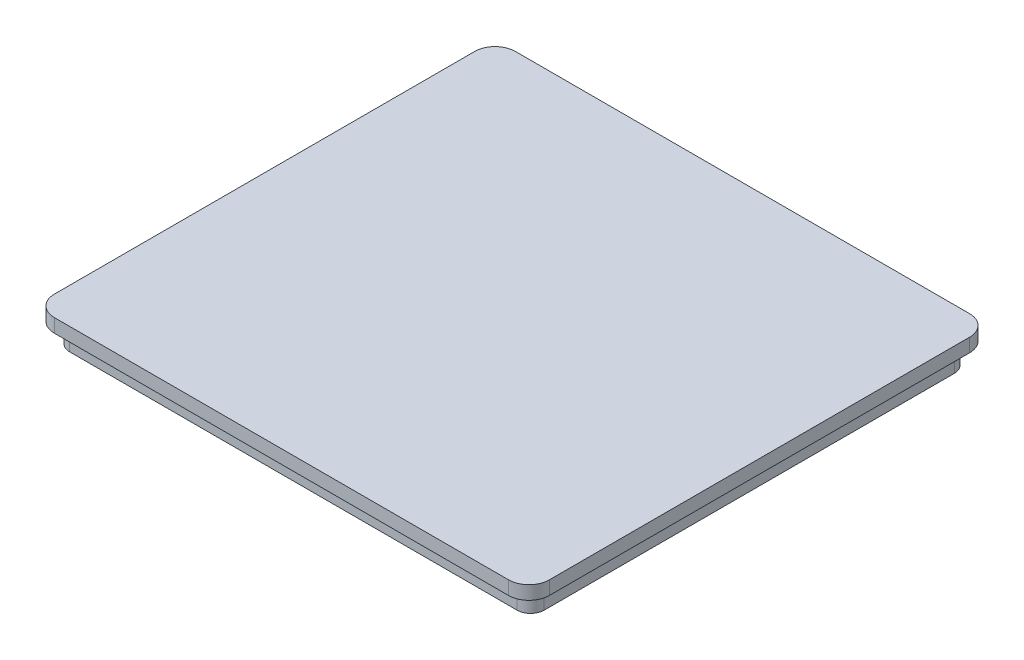
from build123d import *

# Parameters (mm, degrees)
CROQUIS1_W              = 70
CROQUIS1_H              = 64.5
SALIENTE_EXTRUIR1_DEPTH = 3
REDONDEO1_R             = 2
VACIADO2_START          = -33
VACIADO2_OUTLINE_W      = 3
VACIADO2_OUTLINE_H      = 60.5
VACIADO2_DEPTH          = 66
SALIENTE_EXTRUIR2_DEPTH = 2


# Read off the part's stored shape, not the designer's step: Vaciado2
with BuildPart() as part:
    # Croquis1 → Saliente-Extruir1 (new body)
    with BuildSketch(Plane(origin=(0, 0, 0), x_dir=(1, 0, 0), z_dir=(0, 1, 0))):
        with Locations((0, -19.018292683)):
            Rectangle(CROQUIS1_W, CROQUIS1_H)
    extrude(amount=SALIENTE_EXTRUIR1_DEPTH)

    # Redondeo1
    redondeo1_edges = [part.edges().sort_by_distance(p)[0] for p in [
        (-35, 1.5, -13.231707317),
        (35, 1.5, -13.231707317),
        (35, 1.5, 51.268292683),
        (-35, 1.5, 51.268292683),
    ]]
    fillet(redondeo1_edges, radius=REDONDEO1_R)

    # Vaciado2 outline → Vaciado2 (cut)
    with BuildSketch(Plane.YZ.offset(VACIADO2_START)):
        with Locations((1.5, 19.018292683)):
            Rectangle(VACIADO2_OUTLINE_W, VACIADO2_OUTLINE_H)
    extrude(amount=VACIADO2_DEPTH, mode=Mode.SUBTRACT)

    # Croquis4 → Saliente-Extruir2 (add)
    with BuildSketch(Plane(origin=(0, 3, 0), x_dir=(1, 0, 0), z_dir=(0, 1, 0))):
        with BuildLine():
            Line((33.5, -53.018292683), (-33.5, -53.018292683))
            ThreePointArc((-33.5, -53.018292683), (-35.621320344, -52.139613026), (-36.5, -50.018292683))
            Line((-36.5, -50.018292683), (-36.5, 11.981707317))
            ThreePointArc((-36.5, 11.981707317), (-35.621320344, 14.103027661), (-33.5, 14.981707317))
            Line((-33.5, 14.981707317), (33.5, 14.981707317))
            ThreePointArc((33.5, 14.981707317), (35.621320344, 14.103027661), (36.5, 11.981707317))
            Line((36.5, 11.981707317), (36.5, -50.018292683))
            ThreePointArc((36.5, -50.018292683), (35.621320344, -52.139613026), (33.5, -53.018292683))
        make_face()
    extrude(amount=SALIENTE_EXTRUIR2_DEPTH)


solid = part.part
